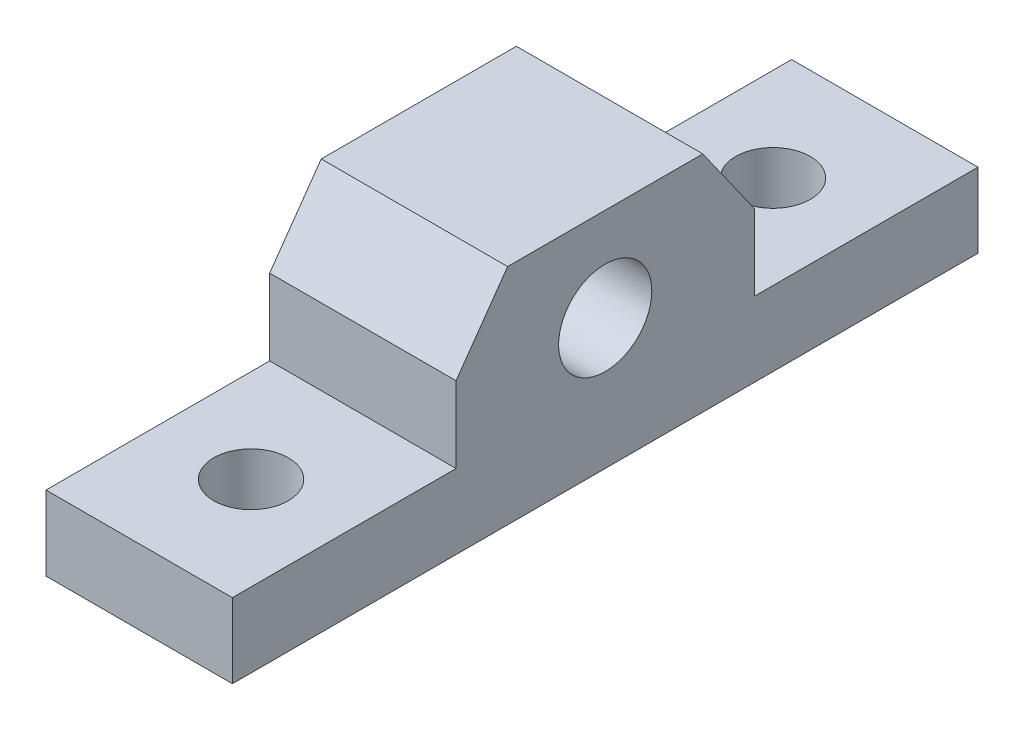
from build123d import *

# Parameters (mm, degrees)
SKETCH_2_R          = 2.5
EXTRUDE_1_DEPTH     = 10
SKETCH_3_R          = 2
CUT_EXTRUDE_2_DEPTH = 43


with BuildPart() as part:
    # Эскиз2 → Вытянуть1 (new body)
    with BuildSketch(Plane(origin=(0, 0, 0), x_dir=(0, 0, -1), z_dir=(1, 0, 0))):
        Polygon((0, 5), (40, 5), (40, 9), (28, 9), (28, 13.077507284), (25.234860189, 17), (14.765139811, 17), (12, 13.077507284), (12, 9), (0, 9), align=None)
        with Locations((20, 12)):
            Circle(SKETCH_2_R, mode=Mode.SUBTRACT)
    extrude(amount=EXTRUDE_1_DEPTH)

    # Эскиз3 → Вытянуть2 (cut, through all)
    with BuildSketch(Plane(origin=(0, 9, 0), x_dir=(1, 0, 0), z_dir=(0, 1, 0))):
        with Locations((5, 6)):
            Circle(SKETCH_3_R)
        with Locations((5, 34)):
            Circle(SKETCH_3_R)
    extrude(amount=-CUT_EXTRUDE_2_DEPTH, mode=Mode.SUBTRACT)


solid = part.part
